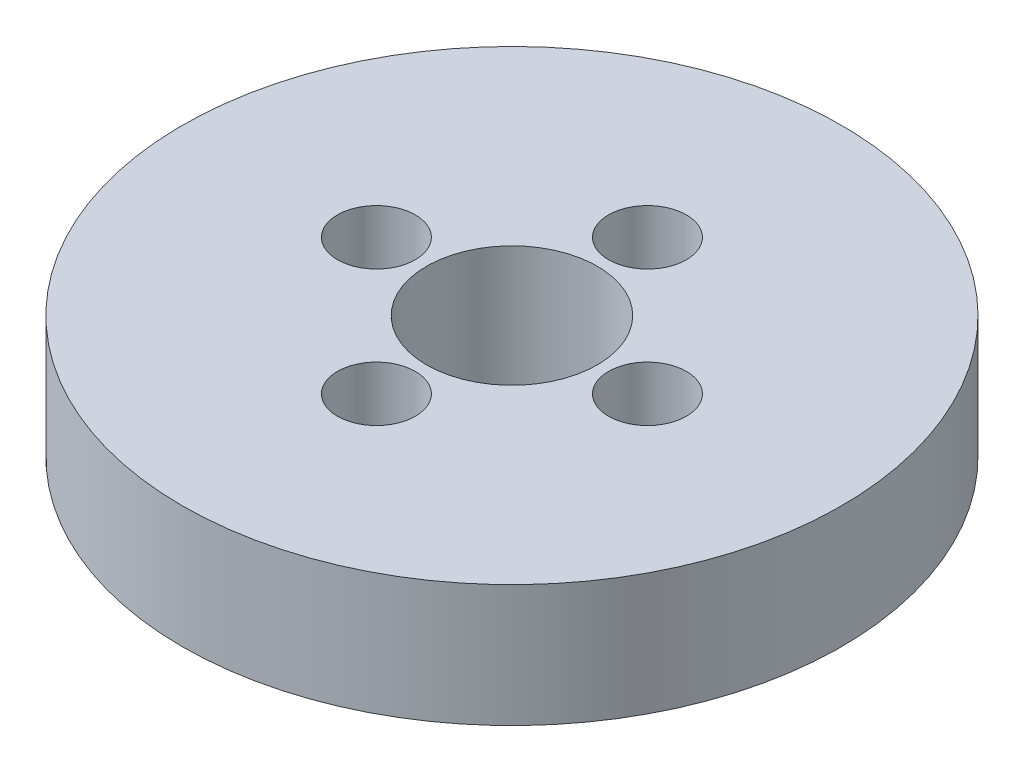
from build123d import *

# Parameters (mm, degrees)
SKETCH1_R           = 67.5
BOSS_EXTRUDE1_DEPTH = 25
SKETCH2_R           = 17.5
CUT_EXTRUDE1_DEPTH  = 99.67877178
SKETCH3_R           = 7.969562978
CUT_EXTRUDE2_DEPTH  = 21.275861771
CIRPATTERN1_COUNT   = 4


with BuildPart() as part:
    # Sketch1 → Boss-Extrude1 (new body)
    with BuildSketch(Plane(origin=(0, 0, 0), x_dir=(1, 0, 0), z_dir=(0, 1, 0))):
        Circle(SKETCH1_R)
    extrude(amount=BOSS_EXTRUDE1_DEPTH)

    # Sketch2 → Cut-Extrude1 (cut, through all)
    with BuildSketch(Plane(origin=(0, 0, 0), x_dir=(1, 0, 0), z_dir=(0, 1, 0))):
        Circle(SKETCH2_R)
    extrude(amount=CUT_EXTRUDE1_DEPTH, mode=Mode.SUBTRACT)

    # Sketch3 → Cut-Extrude2 (cut)
    with BuildSketch(Plane(origin=(0, 25, 0), x_dir=(1, 0, 0), z_dir=(0, 1, 0))):
        with Locations((-27.759501712, 0)):
            Circle(SKETCH3_R)
    cut_extrude2 = extrude(amount=-CUT_EXTRUDE2_DEPTH, mode=Mode.SUBTRACT)

    # CirPattern1: Cut-Extrude2 ×4 about axis
    cirpattern1_axis = Axis((0, 0, 0), (0, 1, 0))
    for i in range(1, CIRPATTERN1_COUNT):
        add(cut_extrude2.rotate(cirpattern1_axis, i * 360 / CIRPATTERN1_COUNT), mode=Mode.SUBTRACT)


solid = part.part
